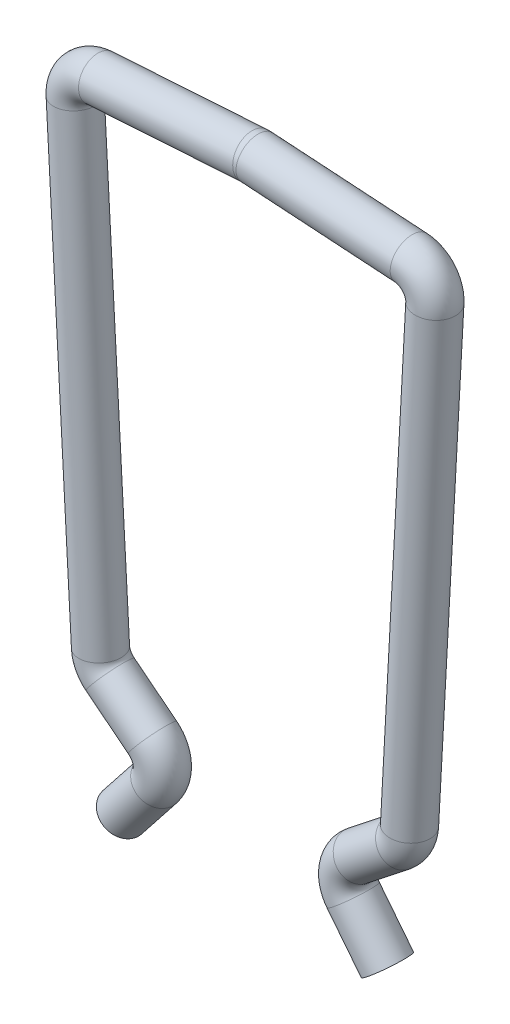
from build123d import *

# Parameters (mm, degrees)
SKETCH2_R = 0.4


with BuildPart() as part:
    # Sweep2: sweep along a path in Sketch1
    with BuildLine(Plane.XY) as sweep2_path:
        Line((-2.259323366, -12.17071085), (-1.593810307, -11.328363713))
        ThreePointArc((-1.593810307, -11.328363713), (-1.406125909, -10.665595593), (-1.74206083, -10.06423485))
        Line((-1.74206083, -10.06423485), (-2.564593413, -9.414376672))
        ThreePointArc((-2.564593413, -9.414376672), (-2.591380008, -9.381934412), (-2.602452378, -9.341345933))
        Line((-2.602452378, -9.341345933), (-3.094619576, -0.298853481))
        ThreePointArc((-3.094619576, -0.298853481), (-3.069551131, -0.227030529), (-3.001205598, -0.193626168))
        Line((-3.001205598, -0.193626168), (-0.006438228, -0.00041537))
        ThreePointArc((-0.006438228, -0.00041537), (0, -0.0002079), (0.006438228, -0.00041537))
        Line((0.006438228, -0.00041537), (3.001205598, -0.193626168))
        ThreePointArc((3.001205598, -0.193626168), (3.069551131, -0.227030529), (3.094619576, -0.298853481))
        Line((3.094619576, -0.298853481), (2.602452378, -9.341345933))
        ThreePointArc((2.602452378, -9.341345933), (2.591380008, -9.381934412), (2.564593413, -9.414376672))
        Line((2.564593413, -9.414376672), (1.74206083, -10.06423485))
        ThreePointArc((1.74206083, -10.06423485), (1.406125909, -10.665595593), (1.593810307, -11.328363713))
        Line((1.593810307, -11.328363713), (2.259323366, -12.17071085))
    # Sketch2 → Sweep2 (sweep)
    with BuildSketch(Plane(origin=(-2.259323366, -12.17071085, 0), x_dir=(-0.7846552142768022, 0.6199324114032319, 0), z_dir=(-0.6199324114032317, -0.7846552142768021, 0))):
        with Locations((0.4, 0)):
            Circle(SKETCH2_R)
    sweep(path=sweep2_path.line)


solid = part.part
